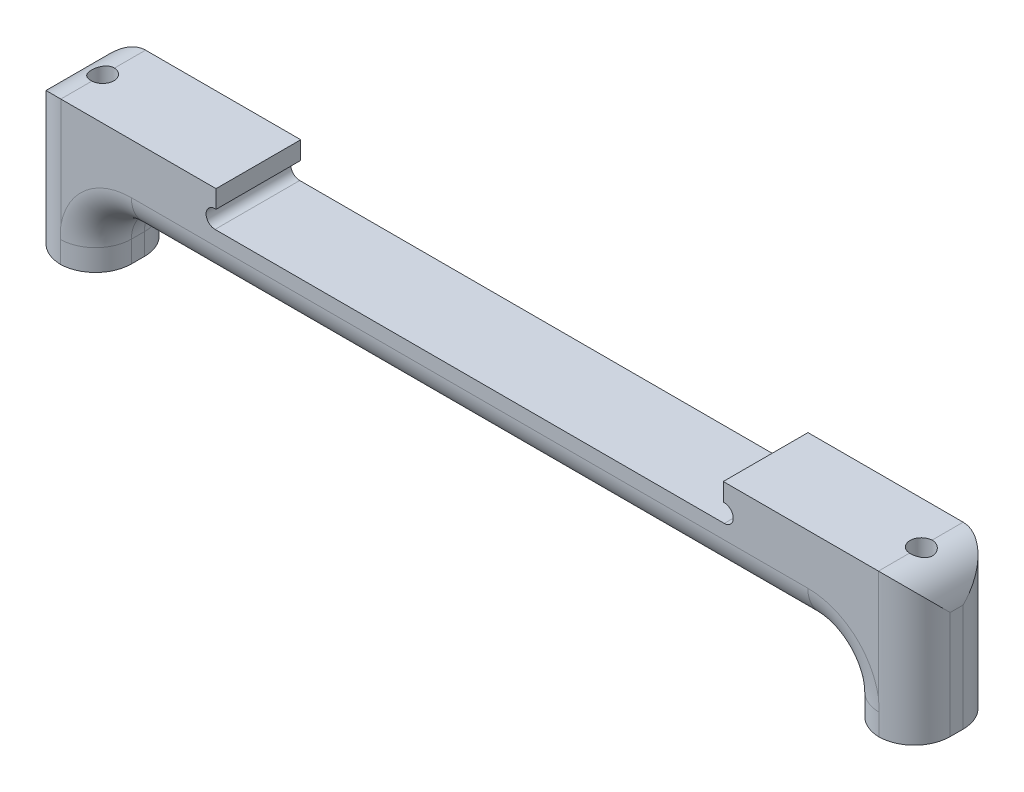
from build123d import *

# Parameters (mm, degrees)
BOSS_EXTRUDE1_DEPTH   = 6
M2X0_4_TAPPED_HOLE1_D = 1.6
FILLET1_R             = 2.54


with BuildPart() as part:
    # Sketch1 → Boss-Extrude1 (new body)
    with BuildSketch(Plane.XY):
        with BuildLine():
            Line((-31.4941, 0), (-26.4941, 0))
            Line((-26.4941, 0), (-26.4941, 1.524))
            ThreePointArc((-26.4941, 1.524), (-25.750151224, 3.320051224), (-23.9541, 4.064))
            Line((-23.9541, 4.064), (23.9541, 4.064))
            ThreePointArc((23.9541, 4.064), (25.750151224, 3.320051224), (26.4941, 1.524))
            Line((26.4941, 1.524), (26.4941, 0))
            Line((26.4941, 0), (31.4941, 0))
            Line((31.4941, 0), (31.4941, 10.156063356))
            Line((31.4941, 10.156063356), (17.963402264, 10.156063356))
            Line((17.963402264, 10.156063356), (17.963402264, 8.886063356))
            ThreePointArc((17.963402264, 8.886063356), (18.668015075, 8.290353704), (18.034, 7.62))
            Line((18.034, 7.62), (-18.034, 7.62))
            ThreePointArc((-18.034, 7.62), (-18.668015075, 8.290353704), (-17.963402264, 8.886063356))
            Line((-17.963402264, 8.886063356), (-17.963402264, 10.156063356))
            Line((-17.963402264, 10.156063356), (-31.4941, 10.156063356))
            Line((-31.4941, 10.156063356), (-31.4941, 0))
        make_face()
    extrude(amount=BOSS_EXTRUDE1_DEPTH)

    # M2x0.4 Tapped Hole1 (through all)
    with Locations(Plane(origin=(0, 0, 0), x_dir=(-1, 0, 0), z_dir=(0, -1, 0))):
        with Locations((28.9941, -3), (-28.9941, -3)):
            Hole(M2X0_4_TAPPED_HOLE1_D / 2)

    # Fillet1
    # the kernel refuses this fillet: 2.54 mm, written as the material it takes off along each edge
    with BuildSketch(Plane(origin=(-26.4941, -6.35, 0), x_dir=(-1, 0, 0), z_dir=(0, 1, 0)), Plane(origin=(26.4941, 1.524, 0), x_dir=(1, 0, 0), z_dir=(0, -1, 0))) as fillet1_piece_1:
        with BuildLine():
            CenterArc((FILLET1_R, FILLET1_R), FILLET1_R, 180, 90)
            Line((0, FILLET1_R), (0, 0))
            Line((0, 0), (FILLET1_R, 0))
        make_face()
    extrude(amount=7.874, mode=Mode.SUBTRACT)
    with BuildSketch(Plane(origin=(-23.9541, 1.524, 0), x_dir=(-1, 0, 0), z_dir=(0, -1, 0))) as fillet1_piece_2:
        with BuildLine():
            CenterArc((2.54 + FILLET1_R, -FILLET1_R), FILLET1_R, 90, 90)
            Line((2.54, -FILLET1_R), (2.54, 0))
            Line((2.54, 0), (2.54 + FILLET1_R, 0))
        make_face()
    revolve(axis=Axis((-23.9541, 1.524, 0), (0, 0, -1)), revolution_arc=90, mode=Mode.SUBTRACT)
    with BuildSketch(Plane(origin=(23.9541, 1.524, 0), x_dir=(0, 1, 0), z_dir=(-1, 0, 0))) as fillet1_piece_3:
        with BuildLine():
            CenterArc((2.54 + FILLET1_R, -FILLET1_R), FILLET1_R, 90, 90)
            Line((2.54, -FILLET1_R), (2.54, 0))
            Line((2.54, 0), (2.54 + FILLET1_R, 0))
        make_face()
    revolve(axis=Axis((23.9541, 1.524, 0), (0, 0, -1)), revolution_arc=90, mode=Mode.SUBTRACT)
    with BuildSketch(Plane(origin=(-26.4941, -6.35, 6), x_dir=(-1, 0, 0), z_dir=(0, 1, 0)), Plane(origin=(26.4941, 1.524, 6), x_dir=(1, 0, 0), z_dir=(0, -1, 0))) as fillet1_piece_4:
        with BuildLine():
            CenterArc((FILLET1_R, -FILLET1_R), FILLET1_R, 90, 90)
            Line((0, -FILLET1_R), (0, 0))
            Line((0, 0), (FILLET1_R, 0))
        make_face()
    extrude(amount=7.874, mode=Mode.SUBTRACT)
    with BuildSketch(Plane(origin=(-23.9541, 1.524, 6), x_dir=(-1, 0, 0), z_dir=(0, -1, 0))) as fillet1_piece_5:
        with BuildLine():
            CenterArc((2.54 + FILLET1_R, FILLET1_R), FILLET1_R, 180, 90)
            Line((2.54, FILLET1_R), (2.54, 0))
            Line((2.54, 0), (2.54 + FILLET1_R, 0))
        make_face()
    revolve(axis=Axis((-23.9541, 1.524, 6), (0, 0, -1)), revolution_arc=90, mode=Mode.SUBTRACT)
    with BuildSketch(Plane(origin=(-23.9541, 4.064, 6), x_dir=(0, 1, 0), z_dir=(1, 0, 0))) as fillet1_piece_6:
        with BuildLine():
            CenterArc((FILLET1_R, -FILLET1_R), FILLET1_R, 90, 90)
            Line((0, -FILLET1_R), (0, 0))
            Line((0, 0), (FILLET1_R, 0))
        make_face()
    extrude(amount=47.9082, mode=Mode.SUBTRACT)
    with BuildSketch(Plane(origin=(23.9541, 1.524, 6), x_dir=(0, 1, 0), z_dir=(-1, 0, 0))) as fillet1_piece_7:
        with BuildLine():
            CenterArc((2.54 + FILLET1_R, FILLET1_R), FILLET1_R, 180, 90)
            Line((2.54, FILLET1_R), (2.54, 0))
            Line((2.54, 0), (2.54 + FILLET1_R, 0))
        make_face()
    revolve(axis=Axis((23.9541, 1.524, 6), (0, 0, -1)), revolution_arc=90, mode=Mode.SUBTRACT)
    with BuildSketch(Plane(origin=(-31.4941, 16.506063356, 0), x_dir=(1, 0, 0), z_dir=(0, -1, 0)), Plane(origin=(31.4941, -6.35, 0), x_dir=(-1, 0, 0), z_dir=(0, 1, 0))) as fillet1_piece_8:
        with BuildLine():
            CenterArc((FILLET1_R, FILLET1_R), FILLET1_R, 180, 90)
            Line((0, FILLET1_R), (0, 0))
            Line((0, 0), (FILLET1_R, 0))
        make_face()
    extrude(amount=22.856063356, mode=Mode.SUBTRACT)
    with BuildSketch(Plane(origin=(-31.4941, 16.506063356, 6), x_dir=(1, 0, 0), z_dir=(0, -1, 0)), Plane(origin=(31.4941, -6.35, 6), x_dir=(-1, 0, 0), z_dir=(0, 1, 0))) as fillet1_piece_9:
        with BuildLine():
            CenterArc((FILLET1_R, -FILLET1_R), FILLET1_R, 90, 90)
            Line((0, -FILLET1_R), (0, 0))
            Line((0, 0), (FILLET1_R, 0))
        make_face()
    extrude(amount=22.856063356, mode=Mode.SUBTRACT)
    with BuildSketch(Plane(origin=(-23.9541, 4.064, 0), x_dir=(0, 1, 0), z_dir=(1, 0, 0))) as fillet1_piece_10:
        with BuildLine():
            CenterArc((FILLET1_R, FILLET1_R), FILLET1_R, 180, 90)
            Line((0, FILLET1_R), (0, 0))
            Line((0, 0), (FILLET1_R, 0))
        make_face()
    extrude(amount=47.9082, mode=Mode.SUBTRACT)
    with BuildSketch(Plane(origin=(31.4941, 10.156063356, -6.35), x_dir=(0, -1, 0), z_dir=(0, 0, 1)), Plane(origin=(-31.4941, 10.156063356, -6.35), x_dir=(1, 0, 0), z_dir=(0, 0, 1))) as fillet1_piece_11:
        with BuildLine():
            CenterArc((FILLET1_R, -FILLET1_R), FILLET1_R, 90, 90)
            Line((0, -FILLET1_R), (0, 0))
            Line((0, 0), (FILLET1_R, 0))
        make_face()
    extrude(amount=18.7, mode=Mode.SUBTRACT)


solid = part.part
